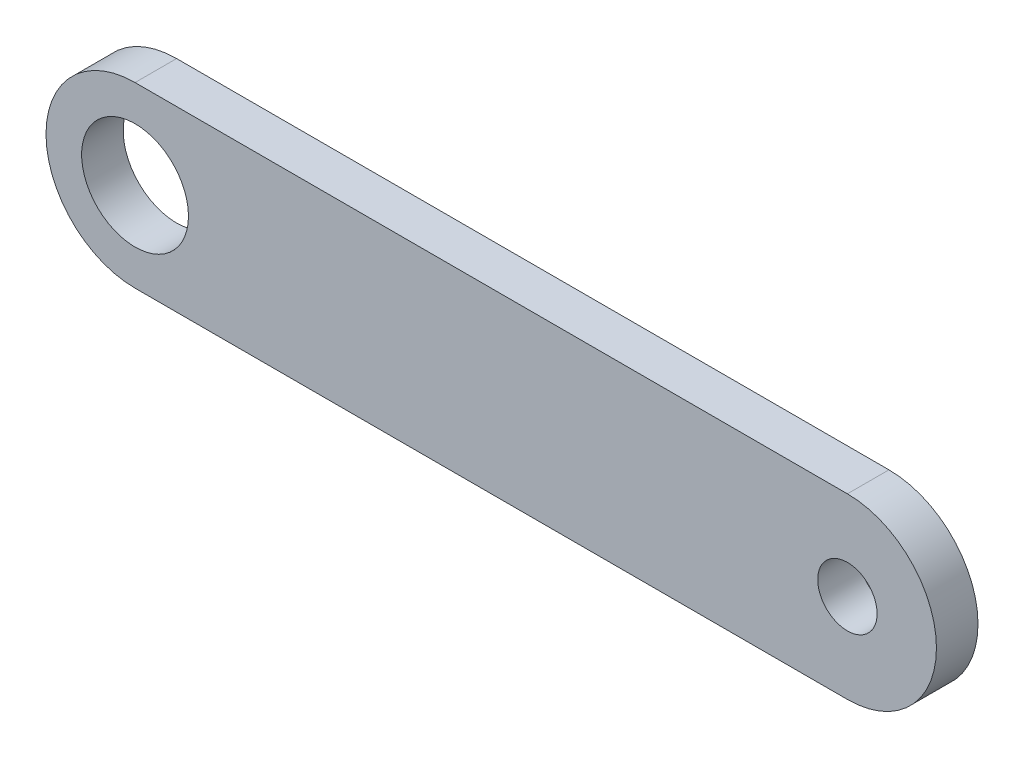
from build123d import *

# Parameters (mm, degrees)
SKETCH_1_R      = 2.5
SKETCH_1_R_2    = 4.5
EXTRUDE_1_DEPTH = 3.5


with BuildPart() as part:
    # 草图1 → 凸台-拉伸1 (new body)
    with BuildSketch(Plane.XY):
        with BuildLine():
            Line((30, 7.5), (-30, 7.5))
            ThreePointArc((-30, 7.5), (-37.5, 0), (-30, -7.5))
            Line((-30, -7.5), (30, -7.5))
            ThreePointArc((30, -7.5), (37.5, 0), (30, 7.5))
        make_face()
        with Locations((30, 0)):
            Circle(SKETCH_1_R, mode=Mode.SUBTRACT)
        with Locations((-30, 0)):
            Circle(SKETCH_1_R_2, mode=Mode.SUBTRACT)
    extrude(amount=EXTRUDE_1_DEPTH)


solid = part.part
